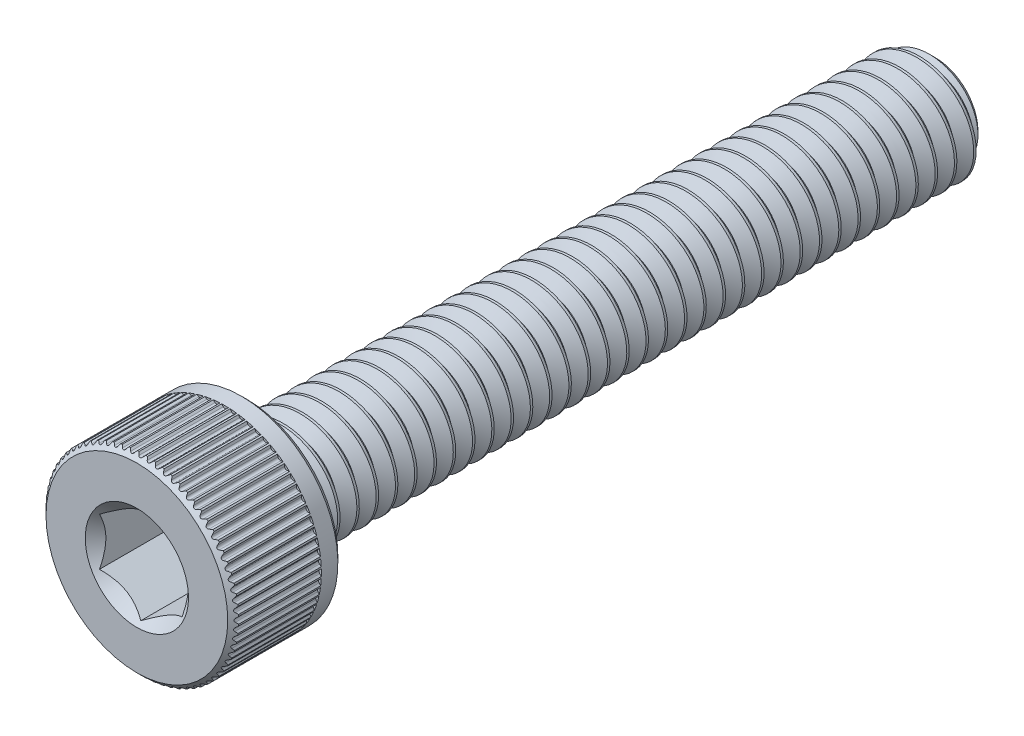
from build123d import *

# Parameters (mm, degrees)
CUT_EXTRUDE1_DEPTH     = 3
SPLIT1_SURFACE_1_BACK  = 31.643
SPLIT1_SURFACE_1_DEPTH = 63.286
SPLIT1_SURFACE_2_BACK  = 31.643
SPLIT1_SURFACE_2_DEPTH = 63.286
CUT_SWEEP1_PITCH       = 0.7
CUT_SWEEP1_TO          = 24.8
CUT_EXTRUDE3_DEPTH     = 3.2
CIRPATTERN1_COUNT      = 72


with BuildPart() as part:
    # Sketch2 → Revolve1 (revolve)
    with BuildSketch(Plane(origin=(0, 0, 0), x_dir=(0, 0, -1), z_dir=(1, 0, 0))):
        with BuildLine():
            Line((-14.5, 0), (-14.5, 3.3))
            Line((-14.5, 3.3), (-14.3, 3.5))
            Line((-14.3, 3.5), (-10.7, 3.5))
            Line((-10.7, 3.5), (-10.5, 3.3))
            Line((-10.5, 3.3), (-10.5, 2.2))
            ThreePointArc((-10.5, 2.2), (-10.441421356, 2.058578644), (-10.3, 2))
            Line((-10.3, 2), (14.045336663, 2))
            Line((14.045336663, 2), (14.5, 1.545336663))
            Line((14.5, 1.545336663), (14.5, 0))
            Line((14.5, 0), (-14.5, 0))
        make_face()
    revolve(axis=Axis((0, 0, -14.5), (0, 0, 1)))

    # Sketch3 → Cut-Extrude1 (cut)
    with BuildSketch(Plane.XY.offset(14.5)):
        Polygon((1.5, -0.866025404), (1.5, 0.866025404), (0, 1.732050808), (-1.5, 0.866025404), (-1.5, -0.866025404), (0, -1.732050808), align=None)
    extrude(amount=-CUT_EXTRUDE1_DEPTH, mode=Mode.SUBTRACT)

    # Cut-Extrude2 cone 1 section (through the dimple's axis) → Cut-Extrude2 (revolve, cut)
    with BuildSketch(Plane(origin=(0, 0, 14.5), x_dir=(0, -1, 0), z_dir=(1, 0, 0))):
        Polygon((0, 0), (1.875, 0), (0, 1.875), align=None)
    revolve(axis=Axis((0, 0, 14.5), (0, 0, -1)), mode=Mode.SUBTRACT)


with BuildPart() as body_2:
    # Split1: the piece behind the surface
    add(part.part)
    # Split1 surface: a surface, the sketch's curves swept straight by 63.286 mm
    with BuildLine(Plane(origin=(0, 0, 0), x_dir=(0, 0, -1), z_dir=(1, 0, 0)).offset(-SPLIT1_SURFACE_1_BACK), mode=Mode.PRIVATE) as split1_surface_1_path:
        Line((-10.3, -3.5), (-10.3, 3.5))
    split1_surface_1 = Shell.extrude(split1_surface_1_path.wire(), (1 * SPLIT1_SURFACE_1_DEPTH, 0 * SPLIT1_SURFACE_1_DEPTH, 0 * SPLIT1_SURFACE_1_DEPTH))
    split(bisect_by=split1_surface_1, keep=Keep.BOTTOM)

    # Cut-Sweep1: arcs per turn and ends read off the stored shape
    # Cut-Sweep1: the profile of Sketch7 screwed along a right-hand helix through 36.714286 turns, 6 arcs to a turn; built about Z, then put on its axis
    cut_sweep1_z = Axis((0, 0, 0), (0, 0, 1))
    cut_sweep1_corners = [(2.037888611, 0, 0.021875), (2.037888611, 0, -0.634375), (1.545336663, 0, -0.35), (1.545336663, 0, -0.2625)]
    with BuildLine(mode=Mode.PRIVATE) as cut_sweep1_profile:
        Line(cut_sweep1_corners[0], cut_sweep1_corners[1])
        Line(cut_sweep1_corners[1], cut_sweep1_corners[2])
        Line(cut_sweep1_corners[2], cut_sweep1_corners[3])
        Line(cut_sweep1_corners[3], cut_sweep1_corners[0])
    cut_sweep1_cap = Face(cut_sweep1_profile.wire())
    cut_sweep1_turn_angles = [0, 30, 60, 90, 120, 150, 180, 210, 240, 270, 300, 330, 360]
    cut_sweep1_turn_weights = [1, 0.8660254037844387, 1, 0.8660254037844387, 1, 0.8660254037844387, 1, 0.8660254037844387, 1, 0.8660254037844387, 1, 0.8660254037844387, 1]
    cut_sweep1_turn_rails = [Edge.make_bspline([Vector(p[0], p[1], 0).rotate(cut_sweep1_z, cut_sweep1_turn_angles[k]) / cut_sweep1_turn_weights[k] + Vector(0, 0, p[2] + CUT_SWEEP1_PITCH * cut_sweep1_turn_angles[k] / 360) for k in range(13)], [0, 0, 0, 1, 1, 2, 2, 3, 3, 4, 4, 5, 5, 6, 6, 6], 2, cut_sweep1_turn_weights) for p in cut_sweep1_corners]
    cut_sweep1_turn_sides = [Face.make_surface_from_curves(cut_sweep1_turn_rails[p[0]], cut_sweep1_turn_rails[p[1]]) for p in [(0, 1), (1, 2), (2, 3), (3, 0)]]
    cut_sweep1_last_angles = [12960, 12990, 13020, 13050, 13080, 13110, 13140, 13170, 13200, 13208.571428571, 13217.142857142]
    cut_sweep1_last_weights = [1, 0.8660254037844387, 1, 0.8660254037844387, 1, 0.8660254037844387, 1, 0.8660254037844387, 1, 0.9888308262256825, 1]
    cut_sweep1_last_rails = [Edge.make_bspline([Vector(p[0], p[1], 0).rotate(cut_sweep1_z, cut_sweep1_last_angles[k]) / cut_sweep1_last_weights[k] + Vector(0, 0, p[2] + CUT_SWEEP1_PITCH * cut_sweep1_last_angles[k] / 360) for k in range(11)], [0, 0, 0, 1, 1, 2, 2, 3, 3, 4, 4, 5, 5, 5], 2, cut_sweep1_last_weights) for p in cut_sweep1_corners]
    cut_sweep1_last_sides = [Face.make_surface_from_curves(cut_sweep1_last_rails[p[0]], cut_sweep1_last_rails[p[1]]) for p in [(0, 1), (1, 2), (2, 3), (3, 0)]]
    cut_sweep1 = Plane(origin=(0, 0, -14.5), x_dir=(0, 1, 0), z_dir=(0, 0, 1)) * split(Solid(Shell([*[p.moved(Location((0, 0, CUT_SWEEP1_PITCH * i))) for i in range(36) for p in cut_sweep1_turn_sides], *cut_sweep1_last_sides, cut_sweep1_cap, cut_sweep1_cap.rotate(cut_sweep1_z, 13217.142857142).moved(Location((0, 0, CUT_SWEEP1_PITCH * 13217.142857142 / 360)))])), bisect_by=Plane.XY.offset(CUT_SWEEP1_TO), keep=Keep.BOTTOM, mode=Mode.PRIVATE)
    add(cut_sweep1, mode=Mode.SUBTRACT)


with BuildPart() as part_1:
    add(part.part)

    # Split1: split by a surface, the side it looks to stays
    # Split1 surface: a surface, the sketch's curves swept straight by 63.286 mm
    with BuildLine(Plane(origin=(0, 0, 0), x_dir=(0, 0, -1), z_dir=(1, 0, 0)).offset(-SPLIT1_SURFACE_2_BACK), mode=Mode.PRIVATE) as split1_surface_2_path:
        Line((-10.3, -3.5), (-10.3, 3.5))
    split1_surface_2 = Shell.extrude(split1_surface_2_path.wire(), (1 * SPLIT1_SURFACE_2_DEPTH, 0 * SPLIT1_SURFACE_2_DEPTH, 0 * SPLIT1_SURFACE_2_DEPTH))
    split(bisect_by=split1_surface_2, keep=Keep.TOP)

    add(body_2.part)  # Revolve2 merges body 2
    # Sketch8 → Revolve2 (revolve)
    with BuildSketch(Plane(origin=(0, 0, 0), x_dir=(0, 0, -1), z_dir=(1, 0, 0)), mode=Mode.PRIVATE) as revolve2_sk:
        Polygon((-10.5, 0), (-10.5, 2), (-10.3, 2), (-9.145299462, 0), align=None)
    revolve(revolve2_sk.sketch.rotate(Axis((0, 0, 9.145299462), (0, 0, 1)), 270), axis=Axis((0, 0, 9.145299462), (0, 0, 1)))

    # Sketch12 → Cut-Extrude3 (cut)
    with BuildSketch(Plane.XY.offset(14.5)):
        with BuildLine():
            Line((-0.211780344, 3.5875), (0.211780344, 3.5875))
            Line((0.211780344, 3.5875), (0.062787974, 3.438507631))
            ThreePointArc((0.062787974, 3.438507631), (0, 3.4125), (-0.062787974, 3.438507631))
            Line((-0.062787974, 3.438507631), (-0.211780344, 3.5875))
        make_face()
    cut_extrude3 = extrude(amount=-CUT_EXTRUDE3_DEPTH, mode=Mode.SUBTRACT)

    # CirPattern1: Cut-Extrude3 ×72 about axis
    cirpattern1_axis = Axis((0, 0, 0), (0, 0, 1))
    for i in range(1, CIRPATTERN1_COUNT):
        add(cut_extrude3.rotate(cirpattern1_axis, i * 360 / CIRPATTERN1_COUNT), mode=Mode.SUBTRACT)


solid = part_1.part
